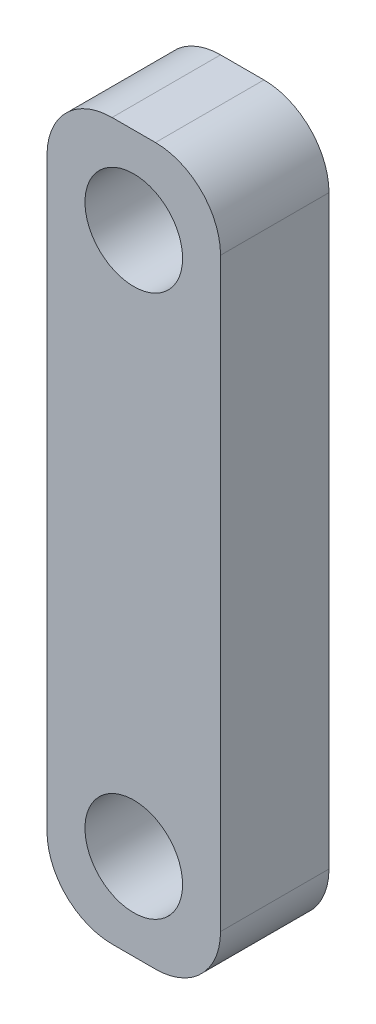
from build123d import *

# Parameters (mm, degrees)
SKETCH1_W           = 8
SKETCH1_H           = 33
SKETCH1_R           = 2.25
BOSS_EXTRUDE1_DEPTH = 5
FILLET1_R           = 3


with BuildPart() as part:
    # Sketch1 → Boss-Extrude1 (new body)
    with BuildSketch(Plane.XY):
        with Locations((4, -16.5)):
            Rectangle(SKETCH1_W, SKETCH1_H)
        with Locations((4, -29)):
            Circle(SKETCH1_R, mode=Mode.SUBTRACT)
        with Locations((4, -4)):
            Circle(SKETCH1_R, mode=Mode.SUBTRACT)
    extrude(amount=BOSS_EXTRUDE1_DEPTH)

    # Fillet1
    fillet1_edges = [part.edges().sort_by_distance(p)[0] for p in [
        (0, -33, 2.5),
        (8, -33, 2.5),
        (0, 0, 2.5),
        (8, 0, 2.5),
    ]]
    fillet(fillet1_edges, radius=FILLET1_R)


solid = part.part
